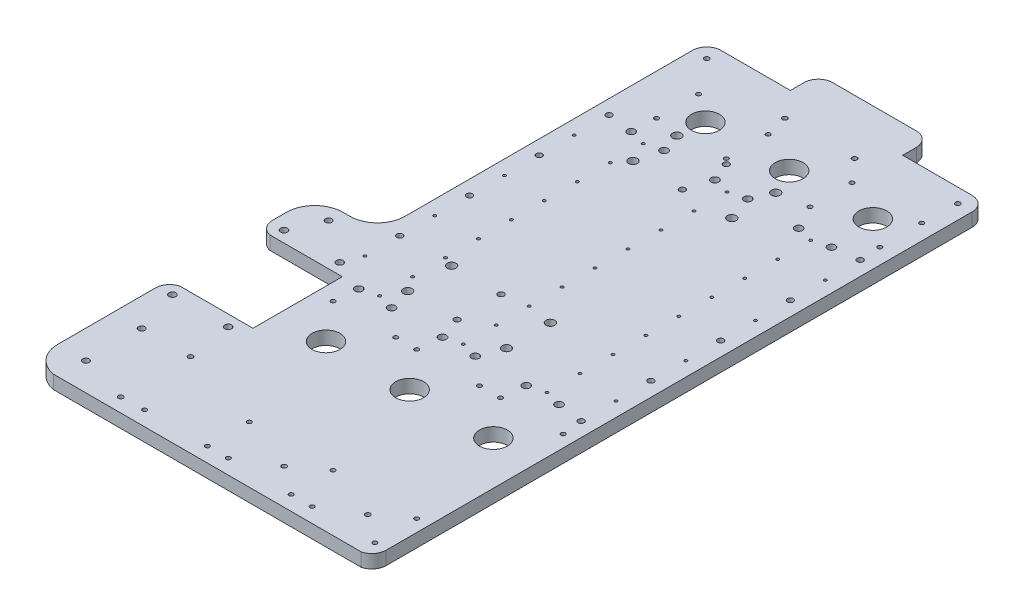
from build123d import *

# Parameters (mm, degrees)
SKETCH1_W                       = 127
SKETCH1_H                       = 152.4
BOSS_EXTRUDE1_DEPTH             = 5.8
M2X0_4_TAPPED_HOLE1_D           = 1.6
M3X0_5_TAPPED_HOLE2_D           = 2.5
M3X0_5_TAPPED_HOLE2_DEPTH       = 7.62
M3X0_5_TAPPED_HOLE2_CBORE_D     = 3
M3X0_5_TAPPED_HOLE2_CBORE_DEPTH = 6.096
M3X0_5_TAPPED_HOLE2_TIP         = 0.751075774
SKETCH13_R                      = 0.79375
CUT_EXTRUDE3_DEPTH              = 199.465110284
SKETCH14_R                      = 1.88087
CUT_EXTRUDE4_DEPTH              = 199.465110284
BOSS_EXTRUDE2_DEPTH             = 5.8
M4_CLEARANCE_HOLE1_D            = 4.3
M4_CLEARANCE_HOLE1_DEPTH        = 9.906
M4_CLEARANCE_HOLE1_TIP          = 1.291850331
SKETCH5_R                       = 1.5
CUT_EXTRUDE2_DEPTH              = 240.693304037
M3X0_5_TAPPED_HOLE1_D           = 2.5
M3X0_5_TAPPED_HOLE1_DEPTH       = 5.842
M3X0_5_TAPPED_HOLE1_TIP         = 0.751075774
SKETCH20_W                      = 127
SKETCH20_H                      = 88.9
BOSS_EXTRUDE3_DEPTH             = 5.8
F_4_40_TAPPED_HOLE1_D           = 2.2606
F_4_40_TAPPED_HOLE1_DEPTH       = 8.89
F_4_40_TAPPED_HOLE1_TIP         = 0.679152758
SKETCH23_R                      = 6.5
CUT_EXTRUDE5_DEPTH              = 240.693304037
F_4_40_TAPPED_HOLE2_D           = 2.2606
F_4_40_TAPPED_HOLE2_DEPTH       = 7.62
F_4_40_TAPPED_HOLE2_TIP         = 0.679152758
M3X0_5_TAPPED_HOLE3_D           = 2.5
M3X0_5_TAPPED_HOLE3_DEPTH       = 7.62
M3X0_5_TAPPED_HOLE3_TIP         = 0.751075774
SKETCH26_W                      = 9.525
SKETCH26_H                      = 40.64
CUT_EXTRUDE6_DEPTH              = 240.693304037
SKETCH27_W                      = 28.575
SKETCH27_H                      = 63.5
SKETCH27_H_2                    = 25.4
BOSS_EXTRUDE4_DEPTH             = 5.8
M3_CLEARANCE_HOLE1_D            = 3.2
M3_CLEARANCE_HOLE1_DEPTH        = 9.906
M3_CLEARANCE_HOLE1_TIP          = 0.96137699
FILLET1_R                       = 6.35
FILLET2_R                       = 12.7
M3_CLEARANCE_HOLE2_D            = 3.4
M3_CLEARANCE_HOLE2_DEPTH        = 12.7
M3_CLEARANCE_HOLE2_TIP          = 1.021463052
MOVE_START                      = -0.149999954
MOVE_FACE1_OUTLINE_R            = 0.650000046
MOVE_FACE1_OUTLINE_R_2          = 0.980300046
MOVE_FACE1_OUTLINE_R_3          = 1.730870046
MOVE_FACE1_OUTLINE_R_4          = 2.000000046
MOVE_FACE1_OUTLINE_R_5          = 6.350000046
MOVE_FACE1_OUTLINE_R_6          = 1.100000046
MOVE_FACE1_OUTLINE_R_7          = 1.350000046
MOVE_FACE1_OUTLINE_R_8          = 1.450000046
MOVE_FACE1_OUTLINE_R_9          = 1.550000046
MOVE_FACE1_OUTLINE_R_10         = 0.643750046
MOVE_FACE1_DEPTH                = 6.099999908


# Read off the part's stored shape, not the designer's step: Move Face1
with BuildPart() as part:
    # Sketch1 → Boss-Extrude1 (new body)
    with BuildSketch(Plane(origin=(0, 0, 0), x_dir=(1, 0, 0), z_dir=(0, 1, 0))):
        with Locations((63.5, 76.2)):
            Rectangle(SKETCH1_W, SKETCH1_H)
    extrude(amount=BOSS_EXTRUDE1_DEPTH)

    # M2x0.4 Tapped Hole1 (through all)
    with Locations(Plane(origin=(0, 5.8, 0), x_dir=(-1, 0, 0), z_dir=(0, 1, 0))):
        with Locations((-63.5, -121.2), (-63.5, -136.2), (-63.5, -76.2), (-63.5, -106.2), (-63.5, -91.2), (-63.5, -61.2), (-63.5, -46.2), (-63.5, -16.2), (-63.5, -31.2), (-25.4, -121.2), (-25.4, -136.2), (-25.4, -76.2), (-25.4, -106.2), (-25.4, -91.2), (-25.4, -61.2), (-25.4, -46.2), (-25.4, -16.2), (-25.4, -31.2), (-101.6, -121.2), (-101.6, -136.2), (-101.6, -76.2), (-101.6, -106.2), (-101.6, -91.2), (-101.6, -61.2), (-101.6, -46.2), (-101.6, -16.2), (-101.6, -31.2)):
            Hole(M2X0_4_TAPPED_HOLE1_D / 2)

    # M3x0.5 Tapped Hole2
    with Locations(Plane(origin=(0, 5.8, 0), x_dir=(-1, 0, 0), z_dir=(0, 1, 0))):
        with Locations((-6.35, -76.2), (-120.65, -76.2), (-6.35, -44.45), (-120.65, -44.45), (-6.35, -12.7), (-120.65, -12.7), (-120.65, -139.7), (-120.65, -107.95), (-6.35, -139.7), (-6.35, -107.95)):
            CounterBoreHole(M3X0_5_TAPPED_HOLE2_D / 2, M3X0_5_TAPPED_HOLE2_CBORE_D / 2, M3X0_5_TAPPED_HOLE2_CBORE_DEPTH, depth=M3X0_5_TAPPED_HOLE2_DEPTH)
            with Locations((0, 0, -(M3X0_5_TAPPED_HOLE2_DEPTH + M3X0_5_TAPPED_HOLE2_TIP / 2))):  # 118° drill point
                Cone(0, M3X0_5_TAPPED_HOLE2_D / 2, M3X0_5_TAPPED_HOLE2_TIP, mode=Mode.SUBTRACT)

    # Sketch13 → Cut-Extrude3 (cut, through all)
    with BuildSketch(Plane(origin=(0, 5.8, 0), x_dir=(1, 0, 0), z_dir=(0, 1, 0))):
        with Locations(Location((6.35, 123.825, 0), (0, 0, 270))):
            Circle(SKETCH13_R)
        with Locations(Location((120.65, 123.825, 0), (0, 0, 270))):
            Circle(SKETCH13_R)
        with Locations(Location((6.35, 28.575, 0), (0, 0, 270))):
            Circle(SKETCH13_R)
        with Locations(Location((120.65, 28.575, 0), (0, 0, 270))):
            Circle(SKETCH13_R)
        with Locations(Location((6.35, 92.075, 0), (0, 0, 270))):
            Circle(SKETCH13_R)
        with Locations(Location((120.65, 92.075, 0), (0, 0, 270))):
            Circle(SKETCH13_R)
        with Locations(Location((120.65, 60.325, 0), (0, 0, 270))):
            Circle(SKETCH13_R)
        with Locations(Location((6.35, 60.325, 0), (0, 0, 270))):
            Circle(SKETCH13_R)
    extrude(amount=-CUT_EXTRUDE3_DEPTH, mode=Mode.SUBTRACT)

    # Sketch14 → Cut-Extrude4 (cut, through all)
    with BuildSketch(Plane(origin=(0, 5.8, 0), x_dir=(-1, 0, 0), z_dir=(0, 1, 0))):
        with Locations(Location((-32.86875, -138.2, 0), (0, 0, 90))):
            Circle(SKETCH14_R)
        with Locations(Location((-109.06875, -138.2, 0), (0, 0, 90))):
            Circle(SKETCH14_R)
        with Locations(Location((-17.93125, -138.2, 0), (0, 0, 270))):
            Circle(SKETCH14_R)
        with Locations(Location((-94.13125, -138.2, 0), (0, 0, 270))):
            Circle(SKETCH14_R)
        with Locations(Location((-17.93125, -14.2, 0), (0, 0, 90))):
            Circle(SKETCH14_R)
        with Locations(Location((-32.86875, -14.2, 0), (0, 0, 270))):
            Circle(SKETCH14_R)
        with Locations(Location((-94.13125, -14.2, 0), (0, 0, 90))):
            Circle(SKETCH14_R)
        with Locations(Location((-109.06875, -14.2, 0), (0, 0, 270))):
            Circle(SKETCH14_R)
        with Locations(Location((-56.03125, -138.2, 0), (0, 0, 90))):
            Circle(SKETCH14_R)
        with Locations(Location((-70.96875, -138.2, 0), (0, 0, 270))):
            Circle(SKETCH14_R)
        with Locations(Location((-70.96875, -14.2, 0), (0, 0, 90))):
            Circle(SKETCH14_R)
        with Locations(Location((-56.03125, -14.2, 0), (0, 0, 270))):
            Circle(SKETCH14_R)
    extrude(amount=-CUT_EXTRUDE4_DEPTH, mode=Mode.SUBTRACT)

    # Sketch15 → Boss-Extrude2 (add, through all)
    with BuildSketch(Plane(origin=(0, 5.8, 0), x_dir=(1, 0, 0), z_dir=(0, 1, 0))):
        Polygon((0, 152.4), (127, 152.4), (127, 190.5), (88.9, 190.5), (88.9, 203.2), (38.1, 203.2), (38.1, 190.5), (0, 190.5), align=None)
    extrude(amount=-BOSS_EXTRUDE2_DEPTH)

    # M4 Clearance Hole1
    with Locations(Plane(origin=(0, 5.8, 0), x_dir=(-1, 0, 0), z_dir=(0, 1, 0))):
        with Locations((-29.92446, -147), (-74.92446, -147), (-29.92446, -127), (-74.92446, -127), (-29.92446, -44.45), (-74.92446, -44.45), (-29.92446, -24.45), (-74.92446, -24.45)):
            Hole(M4_CLEARANCE_HOLE1_D / 2, depth=M4_CLEARANCE_HOLE1_DEPTH)
            with Locations((0, 0, -(M4_CLEARANCE_HOLE1_DEPTH + M4_CLEARANCE_HOLE1_TIP / 2))):  # 118° drill point
                Cone(0, M4_CLEARANCE_HOLE1_D / 2, M4_CLEARANCE_HOLE1_TIP, mode=Mode.SUBTRACT)

    # Sketch5 → Cut-Extrude2 (cut, through all)
    with BuildSketch(Plane(origin=(0, 5.8, 0), x_dir=(-1, 0, 0), z_dir=(0, 1, 0))):
        with Locations(Location((-52.42446, -147, 0), (0, 0, 90))):
            Circle(SKETCH5_R)
        with Locations(Location((-52.42446, -127, 0), (0, 0, 90))):
            Circle(SKETCH5_R)
        with Locations(Location((-52.42446, -44.45, 0), (0, 0, 90))):
            Circle(SKETCH5_R)
        with Locations(Location((-52.42446, -24.45, 0), (0, 0, 90))):
            Circle(SKETCH5_R)
    extrude(amount=-CUT_EXTRUDE2_DEPTH, mode=Mode.SUBTRACT)

    # M3x0.5 Tapped Hole1
    with Locations(Plane(origin=(0, 5.8, 0), x_dir=(-1, 0, 0), z_dir=(0, 1, 0))):
        with Locations((-47.625, -178.435), (-79.375, -178.435)):
            Hole(M3X0_5_TAPPED_HOLE1_D / 2, depth=M3X0_5_TAPPED_HOLE1_DEPTH)
            with Locations((0, 0, -(M3X0_5_TAPPED_HOLE1_DEPTH + M3X0_5_TAPPED_HOLE1_TIP / 2))):  # 118° drill point
                Cone(0, M3X0_5_TAPPED_HOLE1_D / 2, M3X0_5_TAPPED_HOLE1_TIP, mode=Mode.SUBTRACT)

    # Sketch20 → Boss-Extrude3 (add, through all)
    with BuildSketch(Plane(origin=(0, 5.8, 0), x_dir=(1, 0, 0), z_dir=(0, 1, 0))):
        with Locations((63.5, -44.45)):
            Rectangle(SKETCH20_W, SKETCH20_H)
    extrude(amount=-BOSS_EXTRUDE3_DEPTH)

    # #4-40 Tapped Hole1
    with Locations(Plane(origin=(0, 5.8, 0), x_dir=(-1, 0, 0), z_dir=(0, 1, 0))):
        with Locations((-45.45, -3.5), (-16.875, -3.5), (-16.875, 82.225), (-45.45, 82.225), (-45.45, 63.175), (-83.55, -3.5), (-54.975, -3.5), (-54.975, 82.225), (-83.55, 82.225), (-83.55, 63.175), (-121.65, -3.5), (-93.075, -3.5), (-93.075, 82.225), (-121.65, 82.225), (-121.65, 63.175)):
            Hole(F_4_40_TAPPED_HOLE1_D / 2, depth=F_4_40_TAPPED_HOLE1_DEPTH)
            with Locations((0, 0, -(F_4_40_TAPPED_HOLE1_DEPTH + F_4_40_TAPPED_HOLE1_TIP / 2))):  # 118° drill point
                Cone(0, F_4_40_TAPPED_HOLE1_D / 2, F_4_40_TAPPED_HOLE1_TIP, mode=Mode.SUBTRACT)

    # Sketch23 → Cut-Extrude5 (cut, through all)
    with BuildSketch(Plane(origin=(0, 5.8, 0), x_dir=(1, 0, 0), z_dir=(0, 1, 0))):
        with Locations(Location((31.1625, -13.9625, 0), (0, 0, 270))):
            Circle(SKETCH23_R)
        with Locations(Location((69.2625, -13.9625, 0), (0, 0, 270))):
            Circle(SKETCH23_R)
        with Locations(Location((107.3625, -13.9625, 0), (0, 0, 270))):
            Circle(SKETCH23_R)
        with Locations(Location((31.1625, 158.75, 0), (0, 0, 270))):
            Circle(SKETCH23_R)
        with Locations(Location((69.2625, 158.75, 0), (0, 0, 270))):
            Circle(SKETCH23_R)
        with Locations(Location((107.3625, 158.75, 0), (0, 0, 270))):
            Circle(SKETCH23_R)
    extrude(amount=-CUT_EXTRUDE5_DEPTH, mode=Mode.SUBTRACT)

    # #4-40 Tapped Hole2
    with Locations(Plane(origin=(0, 5.8, 0), x_dir=(-1, 0, 0), z_dir=(0, 1, 0))):
        with Locations((-18.4625, -168.275), (-18.4625, -149.225), (-50.2125, -168.275), (-50.2125, -149.225), (-88.3125, -149.225), (-88.3125, -168.275), (-120.0625, -149.225), (-120.0625, -168.275)):
            Hole(F_4_40_TAPPED_HOLE2_D / 2, depth=F_4_40_TAPPED_HOLE2_DEPTH)
            with Locations((0, 0, -(F_4_40_TAPPED_HOLE2_DEPTH + F_4_40_TAPPED_HOLE2_TIP / 2))):  # 118° drill point
                Cone(0, F_4_40_TAPPED_HOLE2_D / 2, F_4_40_TAPPED_HOLE2_TIP, mode=Mode.SUBTRACT)

    # M3x0.5 Tapped Hole3
    with Locations(Plane(origin=(0, 5.8, 0), x_dir=(-1, 0, 0), z_dir=(0, 1, 0))):
        with Locations((-6.35, -184.15), (-120.65, -184.15), (-6.35, 82.55), (-70.85, 72.7), (-108.95, 72.7), (-6.35, 50.8), (-6.35, 19.05)):
            Hole(M3X0_5_TAPPED_HOLE3_D / 2, depth=M3X0_5_TAPPED_HOLE3_DEPTH)
            with Locations((0, 0, -(M3X0_5_TAPPED_HOLE3_DEPTH + M3X0_5_TAPPED_HOLE3_TIP / 2))):  # 118° drill point
                Cone(0, M3X0_5_TAPPED_HOLE3_D / 2, M3X0_5_TAPPED_HOLE3_TIP, mode=Mode.SUBTRACT)

    # Sketch26 → Cut-Extrude6 (cut, through all)
    with BuildSketch(Plane(origin=(0, 5.8, 0), x_dir=(1, 0, 0), z_dir=(0, 1, 0))):
        with Locations((4.7625, -5.08)):
            Rectangle(SKETCH26_W, SKETCH26_H)
    extrude(amount=-CUT_EXTRUDE6_DEPTH, mode=Mode.SUBTRACT)

    # Sketch27 → Boss-Extrude4 (add, through all)
    with BuildSketch(Plane(origin=(0, 5.8, 0), x_dir=(1, 0, 0), z_dir=(0, 1, 0))):
        with Locations((-14.2875, -57.15)):
            Rectangle(SKETCH27_W, SKETCH27_H)
        with Locations((-14.2875, 27.94)):
            Rectangle(SKETCH27_W, SKETCH27_H_2)
    extrude(amount=-BOSS_EXTRUDE4_DEPTH)

    # M3 Clearance Hole1
    with Locations(Plane(origin=(0, 5.8, 0), x_dir=(-1, 0, 0), z_dir=(0, 1, 0))):
        with Locations((15.875, -34.29), (15.875, 50.8), (15.875, 76.2)):
            Hole(M3_CLEARANCE_HOLE1_D / 2, depth=M3_CLEARANCE_HOLE1_DEPTH)
            with Locations((0, 0, -(M3_CLEARANCE_HOLE1_DEPTH + M3_CLEARANCE_HOLE1_TIP / 2))):  # 118° drill point
                Cone(0, M3_CLEARANCE_HOLE1_D / 2, M3_CLEARANCE_HOLE1_TIP, mode=Mode.SUBTRACT)

    # Fillet1
    fillet1_edges = [part.edges().sort_by_distance(p)[0] for p in [
        (0, 2.9, -190.5),
        (38.1, 2.9, -203.2),
        (88.9, 2.9, -203.2),
        (127, 2.9, -190.5),
        (127, 2.9, 88.9),
        (-28.575, 2.9, 25.4),
        (-28.575, 2.9, -15.24),
    ]]
    fillet(fillet1_edges, radius=FILLET1_R)

    # Fillet2
    fillet2_edges = [part.edges().sort_by_distance(p)[0] for p in [
        (-28.575, 2.9, 88.9),
        (0, 2.9, -40.64),
        (-28.575, 2.9, -40.64),
    ]]
    fillet(fillet2_edges, radius=FILLET2_R)

    # M3 Clearance Hole2
    with Locations(Plane(origin=(0, 5.8, 0), x_dir=(-1, 0, 0), z_dir=(0, 1, 0))):
        with Locations((22.225, -20.32), (-3.175, -20.32), (-3.175, 30.48), (22.225, 30.48)):
            Hole(M3_CLEARANCE_HOLE2_D / 2, depth=M3_CLEARANCE_HOLE2_DEPTH)
            with Locations((0, 0, -(M3_CLEARANCE_HOLE2_DEPTH + M3_CLEARANCE_HOLE2_TIP / 2))):  # 118° drill point
                Cone(0, M3_CLEARANCE_HOLE2_D / 2, M3_CLEARANCE_HOLE2_TIP, mode=Mode.SUBTRACT)

    # Move Face1 outline → Move Face1 (add)
    with BuildSketch(Plane(origin=(0, 0, 0), x_dir=(1, 0, 0), z_dir=(0, 1, 0)).offset(MOVE_START)):
        with BuildLine():
            Line((-0.149999954, 184.15), (-0.149999954, 53.34))
            ThreePointArc((-0.149999954, 53.34), (-3.825809864, 44.465809864), (-12.7, 40.789999954))
            Line((-12.7, 40.789999954), (-15.875, 40.789999954))
            ThreePointArc((-15.875, 40.789999954), (-24.961322106, 37.026322106), (-28.724999954, 27.94))
            Line((-28.724999954, 27.94), (-28.724999954, 21.59))
            ThreePointArc((-28.724999954, 21.59), (-27.288310979, 17.514109749), (-23.613344122, 15.24))
            Line((-23.613344122, 15.24), (9.375000046, 15.24))
            Line((9.375000046, 15.24), (9.375000046, -25.4))
            Line((9.375000046, -25.4), (-23.613344122, -25.4))
            ThreePointArc((-23.613344122, -25.4), (-27.288310979, -27.674109749), (-28.724999954, -31.75))
            Line((-28.724999954, -31.75), (-28.724999954, -76.2))
            ThreePointArc((-28.724999954, -76.2), (-25.628938866, -84.565594744), (-17.832676893, -88.9))
            Line((-17.832676893, -88.9), (122.038344122, -88.9))
            ThreePointArc((122.038344122, -88.9), (125.713310979, -86.625890251), (127.149999954, -82.55))
            Line((127.149999954, -82.55), (127.149999954, 184.15))
            ThreePointArc((127.149999954, 184.15), (125.246194045, 188.746194045), (120.65, 190.649999954))
            Line((120.65, 190.649999954), (89.049999954, 190.649999954))
            Line((89.049999954, 190.649999954), (89.049999954, 196.85))
            ThreePointArc((89.049999954, 196.85), (87.146194045, 201.446194045), (82.55, 203.349999954))
            Line((82.55, 203.349999954), (44.45, 203.349999954))
            ThreePointArc((44.45, 203.349999954), (39.853805955, 201.446194045), (37.950000046, 196.85))
            Line((37.950000046, 196.85), (37.950000046, 190.649999954))
            Line((37.950000046, 190.649999954), (6.35, 190.649999954))
            ThreePointArc((6.35, 190.649999954), (1.753805955, 188.746194045), (-0.149999954, 184.15))
        make_face()
        with Locations((63.5, 136.2)):
            Circle(MOVE_FACE1_OUTLINE_R, mode=Mode.SUBTRACT)
        with Locations((50.2125, 149.225)):
            Circle(MOVE_FACE1_OUTLINE_R_2, mode=Mode.SUBTRACT)
        with Locations((70.96875, 138.2)):
            Circle(MOVE_FACE1_OUTLINE_R_3, mode=Mode.SUBTRACT)
        with Locations((74.92446, 147)):
            Circle(MOVE_FACE1_OUTLINE_R_4, mode=Mode.SUBTRACT)
        with Locations((69.2625, 158.75)):
            Circle(MOVE_FACE1_OUTLINE_R_5, mode=Mode.SUBTRACT)
        with Locations((50.2125, 168.275)):
            Circle(MOVE_FACE1_OUTLINE_R_2, mode=Mode.SUBTRACT)
        with Locations((79.375, 178.435)):
            Circle(MOVE_FACE1_OUTLINE_R_6, mode=Mode.SUBTRACT)
        with Locations((94.13125, 138.2)):
            Circle(MOVE_FACE1_OUTLINE_R_3, mode=Mode.SUBTRACT)
        with Locations((101.6, 136.2)):
            Circle(MOVE_FACE1_OUTLINE_R, mode=Mode.SUBTRACT)
        with Locations((88.3125, 149.225)):
            Circle(MOVE_FACE1_OUTLINE_R_2, mode=Mode.SUBTRACT)
        with Locations((107.3625, 158.75)):
            Circle(MOVE_FACE1_OUTLINE_R_5, mode=Mode.SUBTRACT)
        with Locations((109.06875, 138.2)):
            Circle(MOVE_FACE1_OUTLINE_R_3, mode=Mode.SUBTRACT)
        with Locations((120.65, 139.7)):
            Circle(MOVE_FACE1_OUTLINE_R_7, mode=Mode.SUBTRACT)
        with Locations((120.0625, 149.225)):
            Circle(MOVE_FACE1_OUTLINE_R_2, mode=Mode.SUBTRACT)
        with Locations((88.3125, 168.275)):
            Circle(MOVE_FACE1_OUTLINE_R_2, mode=Mode.SUBTRACT)
        with Locations((120.0625, 168.275)):
            Circle(MOVE_FACE1_OUTLINE_R_2, mode=Mode.SUBTRACT)
        with Locations((120.65, 184.15)):
            Circle(MOVE_FACE1_OUTLINE_R_6, mode=Mode.SUBTRACT)
        with Locations((-15.875, -76.2)):
            Circle(MOVE_FACE1_OUTLINE_R_8, mode=Mode.SUBTRACT)
        with Locations((6.35, -82.55)):
            Circle(MOVE_FACE1_OUTLINE_R_6, mode=Mode.SUBTRACT)
        with Locations((-15.875, -50.8)):
            Circle(MOVE_FACE1_OUTLINE_R_8, mode=Mode.SUBTRACT)
        with Locations((-22.225, -30.48)):
            Circle(MOVE_FACE1_OUTLINE_R_9, mode=Mode.SUBTRACT)
        with Locations((6.35, -50.8)):
            Circle(MOVE_FACE1_OUTLINE_R_6, mode=Mode.SUBTRACT)
        with Locations((3.175, -30.48)):
            Circle(MOVE_FACE1_OUTLINE_R_9, mode=Mode.SUBTRACT)
        with Locations((16.875, -82.225)):
            Circle(MOVE_FACE1_OUTLINE_R_2, mode=Mode.SUBTRACT)
        with Locations((45.45, -82.225)):
            Circle(MOVE_FACE1_OUTLINE_R_2, mode=Mode.SUBTRACT)
        with Locations((45.45, -63.175)):
            Circle(MOVE_FACE1_OUTLINE_R_2, mode=Mode.SUBTRACT)
        with Locations((-22.225, 20.32)):
            Circle(MOVE_FACE1_OUTLINE_R_9, mode=Mode.SUBTRACT)
        with Locations((3.175, 20.32)):
            Circle(MOVE_FACE1_OUTLINE_R_9, mode=Mode.SUBTRACT)
        with Locations((-15.875, 34.29)):
            Circle(MOVE_FACE1_OUTLINE_R_8, mode=Mode.SUBTRACT)
        with Locations((6.35, 28.575)):
            Circle(MOVE_FACE1_OUTLINE_R_10, mode=Mode.SUBTRACT)
        with Locations((6.35, 44.45)):
            Circle(MOVE_FACE1_OUTLINE_R_7, mode=Mode.SUBTRACT)
        with Locations((16.875, 3.5)):
            Circle(MOVE_FACE1_OUTLINE_R_2, mode=Mode.SUBTRACT)
        with Locations((17.93125, 14.2)):
            Circle(MOVE_FACE1_OUTLINE_R_3, mode=Mode.SUBTRACT)
        with Locations((25.4, 16.2)):
            Circle(MOVE_FACE1_OUTLINE_R, mode=Mode.SUBTRACT)
        with Locations((31.1625, -13.9625)):
            Circle(MOVE_FACE1_OUTLINE_R_5, mode=Mode.SUBTRACT)
        with Locations((32.86875, 14.2)):
            Circle(MOVE_FACE1_OUTLINE_R_3, mode=Mode.SUBTRACT)
        with Locations((45.45, 3.5)):
            Circle(MOVE_FACE1_OUTLINE_R_2, mode=Mode.SUBTRACT)
        with Locations((25.4, 31.2)):
            Circle(MOVE_FACE1_OUTLINE_R, mode=Mode.SUBTRACT)
        with Locations((25.4, 46.2)):
            Circle(MOVE_FACE1_OUTLINE_R, mode=Mode.SUBTRACT)
        with Locations((29.92446, 24.45)):
            Circle(MOVE_FACE1_OUTLINE_R_4, mode=Mode.SUBTRACT)
        with Locations((29.92446, 44.45)):
            Circle(MOVE_FACE1_OUTLINE_R_4, mode=Mode.SUBTRACT)
        with Locations((54.975, -82.225)):
            Circle(MOVE_FACE1_OUTLINE_R_2, mode=Mode.SUBTRACT)
        with Locations((70.85, -72.7)):
            Circle(MOVE_FACE1_OUTLINE_R_6, mode=Mode.SUBTRACT)
        with Locations((83.55, -82.225)):
            Circle(MOVE_FACE1_OUTLINE_R_2, mode=Mode.SUBTRACT)
        with Locations((83.55, -63.175)):
            Circle(MOVE_FACE1_OUTLINE_R_2, mode=Mode.SUBTRACT)
        with Locations((93.075, -82.225)):
            Circle(MOVE_FACE1_OUTLINE_R_2, mode=Mode.SUBTRACT)
        with Locations((108.95, -72.7)):
            Circle(MOVE_FACE1_OUTLINE_R_6, mode=Mode.SUBTRACT)
        with Locations((121.65, -82.225)):
            Circle(MOVE_FACE1_OUTLINE_R_2, mode=Mode.SUBTRACT)
        with Locations((121.65, -63.175)):
            Circle(MOVE_FACE1_OUTLINE_R_2, mode=Mode.SUBTRACT)
        with Locations((54.975, 3.5)):
            Circle(MOVE_FACE1_OUTLINE_R_2, mode=Mode.SUBTRACT)
        with Locations((56.03125, 14.2)):
            Circle(MOVE_FACE1_OUTLINE_R_3, mode=Mode.SUBTRACT)
        with Locations((63.5, 16.2)):
            Circle(MOVE_FACE1_OUTLINE_R, mode=Mode.SUBTRACT)
        with Locations((69.2625, -13.9625)):
            Circle(MOVE_FACE1_OUTLINE_R_5, mode=Mode.SUBTRACT)
        with Locations((70.96875, 14.2)):
            Circle(MOVE_FACE1_OUTLINE_R_3, mode=Mode.SUBTRACT)
        with Locations((83.55, 3.5)):
            Circle(MOVE_FACE1_OUTLINE_R_2, mode=Mode.SUBTRACT)
        with Locations((52.42446, 24.45)):
            Circle(MOVE_FACE1_OUTLINE_R_7, mode=Mode.SUBTRACT)
        with Locations((63.5, 31.2)):
            Circle(MOVE_FACE1_OUTLINE_R, mode=Mode.SUBTRACT)
        with Locations((52.42446, 44.45)):
            Circle(MOVE_FACE1_OUTLINE_R_7, mode=Mode.SUBTRACT)
        with Locations((63.5, 46.2)):
            Circle(MOVE_FACE1_OUTLINE_R, mode=Mode.SUBTRACT)
        with Locations((74.92446, 24.45)):
            Circle(MOVE_FACE1_OUTLINE_R_4, mode=Mode.SUBTRACT)
        with Locations((74.92446, 44.45)):
            Circle(MOVE_FACE1_OUTLINE_R_4, mode=Mode.SUBTRACT)
        with Locations((107.3625, -13.9625)):
            Circle(MOVE_FACE1_OUTLINE_R_5, mode=Mode.SUBTRACT)
        with Locations((93.075, 3.5)):
            Circle(MOVE_FACE1_OUTLINE_R_2, mode=Mode.SUBTRACT)
        with Locations((94.13125, 14.2)):
            Circle(MOVE_FACE1_OUTLINE_R_3, mode=Mode.SUBTRACT)
        with Locations((101.6, 16.2)):
            Circle(MOVE_FACE1_OUTLINE_R, mode=Mode.SUBTRACT)
        with Locations((109.06875, 14.2)):
            Circle(MOVE_FACE1_OUTLINE_R_3, mode=Mode.SUBTRACT)
        with Locations((121.65, 3.5)):
            Circle(MOVE_FACE1_OUTLINE_R_2, mode=Mode.SUBTRACT)
        with Locations((120.65, 12.7)):
            Circle(MOVE_FACE1_OUTLINE_R_7, mode=Mode.SUBTRACT)
        with Locations((101.6, 31.2)):
            Circle(MOVE_FACE1_OUTLINE_R, mode=Mode.SUBTRACT)
        with Locations((101.6, 46.2)):
            Circle(MOVE_FACE1_OUTLINE_R, mode=Mode.SUBTRACT)
        with Locations((120.65, 28.575)):
            Circle(MOVE_FACE1_OUTLINE_R_10, mode=Mode.SUBTRACT)
        with Locations((120.65, 44.45)):
            Circle(MOVE_FACE1_OUTLINE_R_7, mode=Mode.SUBTRACT)
        with Locations((6.35, 60.325)):
            Circle(MOVE_FACE1_OUTLINE_R_10, mode=Mode.SUBTRACT)
        with Locations((6.35, 76.2)):
            Circle(MOVE_FACE1_OUTLINE_R_7, mode=Mode.SUBTRACT)
        with Locations((6.35, 92.075)):
            Circle(MOVE_FACE1_OUTLINE_R_10, mode=Mode.SUBTRACT)
        with Locations((6.35, 107.95)):
            Circle(MOVE_FACE1_OUTLINE_R_7, mode=Mode.SUBTRACT)
        with Locations((6.35, 123.825)):
            Circle(MOVE_FACE1_OUTLINE_R_10, mode=Mode.SUBTRACT)
        with Locations((25.4, 61.2)):
            Circle(MOVE_FACE1_OUTLINE_R, mode=Mode.SUBTRACT)
        with Locations((25.4, 76.2)):
            Circle(MOVE_FACE1_OUTLINE_R, mode=Mode.SUBTRACT)
        with Locations((25.4, 91.2)):
            Circle(MOVE_FACE1_OUTLINE_R, mode=Mode.SUBTRACT)
        with Locations((25.4, 106.2)):
            Circle(MOVE_FACE1_OUTLINE_R, mode=Mode.SUBTRACT)
        with Locations((25.4, 121.2)):
            Circle(MOVE_FACE1_OUTLINE_R, mode=Mode.SUBTRACT)
        with Locations((29.92446, 127)):
            Circle(MOVE_FACE1_OUTLINE_R_4, mode=Mode.SUBTRACT)
        with Locations((6.35, 139.7)):
            Circle(MOVE_FACE1_OUTLINE_R_7, mode=Mode.SUBTRACT)
        with Locations((6.35, 184.15)):
            Circle(MOVE_FACE1_OUTLINE_R_6, mode=Mode.SUBTRACT)
        with Locations((17.93125, 138.2)):
            Circle(MOVE_FACE1_OUTLINE_R_3, mode=Mode.SUBTRACT)
        with Locations((25.4, 136.2)):
            Circle(MOVE_FACE1_OUTLINE_R, mode=Mode.SUBTRACT)
        with Locations((18.4625, 149.225)):
            Circle(MOVE_FACE1_OUTLINE_R_2, mode=Mode.SUBTRACT)
        with Locations((32.86875, 138.2)):
            Circle(MOVE_FACE1_OUTLINE_R_3, mode=Mode.SUBTRACT)
        with Locations((29.92446, 147)):
            Circle(MOVE_FACE1_OUTLINE_R_4, mode=Mode.SUBTRACT)
        with Locations((31.1625, 158.75)):
            Circle(MOVE_FACE1_OUTLINE_R_5, mode=Mode.SUBTRACT)
        with Locations((18.4625, 168.275)):
            Circle(MOVE_FACE1_OUTLINE_R_2, mode=Mode.SUBTRACT)
        with Locations((47.625, 178.435)):
            Circle(MOVE_FACE1_OUTLINE_R_6, mode=Mode.SUBTRACT)
        with Locations((63.5, 61.2)):
            Circle(MOVE_FACE1_OUTLINE_R, mode=Mode.SUBTRACT)
        with Locations((63.5, 76.2)):
            Circle(MOVE_FACE1_OUTLINE_R, mode=Mode.SUBTRACT)
        with Locations((63.5, 91.2)):
            Circle(MOVE_FACE1_OUTLINE_R, mode=Mode.SUBTRACT)
        with Locations((63.5, 106.2)):
            Circle(MOVE_FACE1_OUTLINE_R, mode=Mode.SUBTRACT)
        with Locations((52.42446, 127)):
            Circle(MOVE_FACE1_OUTLINE_R_7, mode=Mode.SUBTRACT)
        with Locations((63.5, 121.2)):
            Circle(MOVE_FACE1_OUTLINE_R, mode=Mode.SUBTRACT)
        with Locations((74.92446, 127)):
            Circle(MOVE_FACE1_OUTLINE_R_4, mode=Mode.SUBTRACT)
        with Locations((101.6, 61.2)):
            Circle(MOVE_FACE1_OUTLINE_R, mode=Mode.SUBTRACT)
        with Locations((101.6, 76.2)):
            Circle(MOVE_FACE1_OUTLINE_R, mode=Mode.SUBTRACT)
        with Locations((101.6, 91.2)):
            Circle(MOVE_FACE1_OUTLINE_R, mode=Mode.SUBTRACT)
        with Locations((120.65, 60.325)):
            Circle(MOVE_FACE1_OUTLINE_R_10, mode=Mode.SUBTRACT)
        with Locations((120.65, 76.2)):
            Circle(MOVE_FACE1_OUTLINE_R_7, mode=Mode.SUBTRACT)
        with Locations((120.65, 92.075)):
            Circle(MOVE_FACE1_OUTLINE_R_10, mode=Mode.SUBTRACT)
        with Locations((101.6, 106.2)):
            Circle(MOVE_FACE1_OUTLINE_R, mode=Mode.SUBTRACT)
        with Locations((101.6, 121.2)):
            Circle(MOVE_FACE1_OUTLINE_R, mode=Mode.SUBTRACT)
        with Locations((120.65, 107.95)):
            Circle(MOVE_FACE1_OUTLINE_R_7, mode=Mode.SUBTRACT)
        with Locations((120.65, 123.825)):
            Circle(MOVE_FACE1_OUTLINE_R_10, mode=Mode.SUBTRACT)
        with Locations((56.03125, 138.2)):
            Circle(MOVE_FACE1_OUTLINE_R_3, mode=Mode.SUBTRACT)
        with Locations((52.42446, 147)):
            Circle(MOVE_FACE1_OUTLINE_R_7, mode=Mode.SUBTRACT)
    extrude(amount=MOVE_FACE1_DEPTH)


solid = part.part
